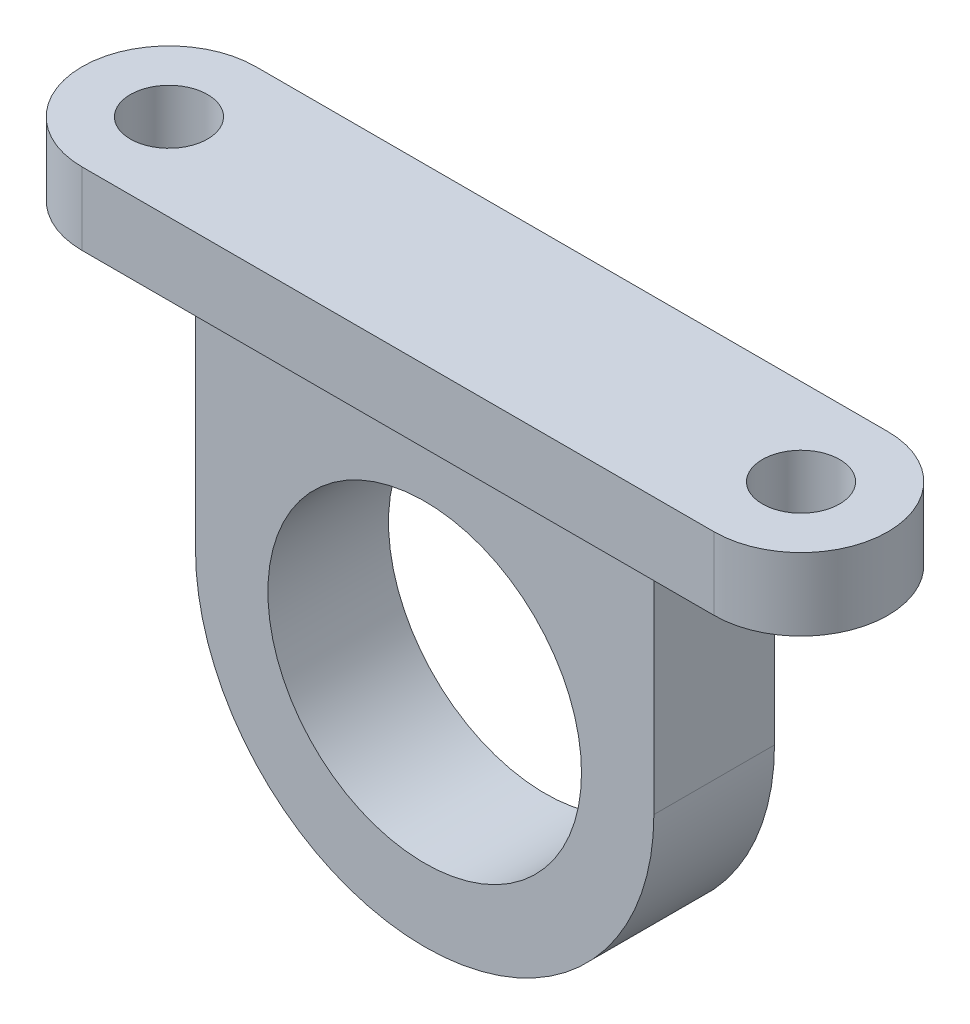
from build123d import *

# Parameters (mm, degrees)
SKETCH1_R           = 6.5
BOSS_EXTRUDE1_DEPTH = 5
SKETCH2_R           = 1.6
BOSS_EXTRUDE2_DEPTH = 3


with BuildPart() as part:
    # Sketch1 → Boss-Extrude1 (new body)
    with BuildSketch(Plane.XY):
        with BuildLine():
            Line((-9.5, 0), (-9.5, 9.5))
            Line((-9.5, 9.5), (9.5, 9.5))
            Line((9.5, 9.5), (9.5, 0))
            ThreePointArc((9.5, 0), (0, -9.5), (-9.5, 0))
        make_face()
        Circle(SKETCH1_R, mode=Mode.SUBTRACT)
    extrude(amount=BOSS_EXTRUDE1_DEPTH)

    # Sketch2 → Boss-Extrude2 (add)
    with BuildSketch(Plane(origin=(0, 9.5, 0), x_dir=(1, 0, 0), z_dir=(0, 1, 0))):
        with BuildLine():
            ThreePointArc((13.1, -6.1), (16.7, -2.5), (13.1, 1.1))
            Line((13.1, 1.1), (-13.1, 1.1))
            ThreePointArc((-13.1, 1.1), (-16.7, -2.5), (-13.1, -6.1))
            Line((-13.1, -6.1), (13.1, -6.1))
        make_face()
        with Locations((-13.1, -2.5)):
            Circle(SKETCH2_R, mode=Mode.SUBTRACT)
        with Locations((13.1, -2.5)):
            Circle(SKETCH2_R, mode=Mode.SUBTRACT)
    extrude(amount=BOSS_EXTRUDE2_DEPTH)


solid = part.part
